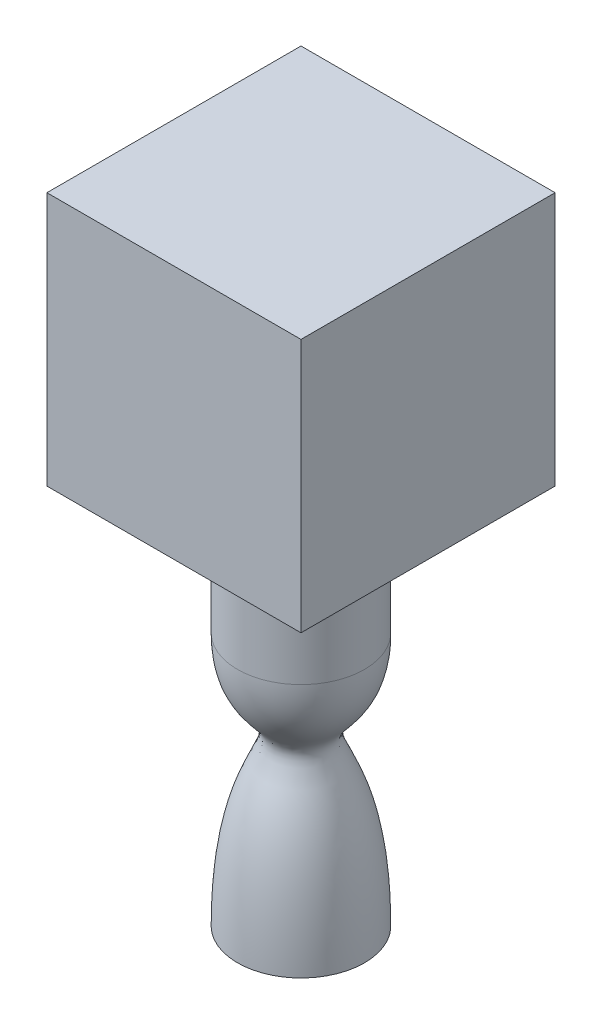
from build123d import *

# Parameters (mm, degrees)
REVOLVE1_OUTLINE_W   = 5
REVOLVE1_OUTLINE_H   = 100
REVOLVE1_OUTLINE_W_2 = 45
SKETCH2_W            = 200
SKETCH2_H            = 200
BOSS_EXTRUDE1_DEPTH  = 200


# Read off the part's stored shape, not the designer's step: Revolve1
with BuildPart() as part:
    # Revolve1 outline → Revolve1 (revolve)
    with BuildSketch(Plane(origin=(50, 0, 0), x_dir=(1, 0, 0), z_dir=(0, 0, 1))):
        with Locations((47.5, 50)):
            Rectangle(REVOLVE1_OUTLINE_W, REVOLVE1_OUTLINE_H)
        with BuildLine():
            add(Edge.make_bspline(
                [(50, 0), (50, -8.082762567), (49.349957781, -15.002219913), (48.209745328, -20.96390459), (46.719575094, -26.132708235), (45, -30.644804173)],
                knots=[0, 0, 0, 0, 0, 0, 0.122970463, 0.122970463, 0.122970463, 0.122970463, 0.122970463, 0.122970463], degree=5))
            Line((50, 0), (45, 0))
            Line((45, 0), (45, -30.644804173))
        make_face()
        with Locations((22.5, 50)):
            Rectangle(REVOLVE1_OUTLINE_W_2, REVOLVE1_OUTLINE_H)
        with BuildLine():
            add(Edge.make_bspline(
                [(45, -30.644804173), (34.455506857, -58.313130409), (15.284968329, -61.288036888), (15.284968329, -70.967793904), (34.455506857, -78.145887533), (45, -136.380827106)],
                knots=[0.122970463, 0.122970463, 0.122970463, 0.122970463, 0.122970463, 0.122970463, 0.877029537, 0.877029537, 0.877029537, 0.877029537, 0.877029537, 0.877029537], degree=5))
            Line((45, -30.644804173), (45, 0))
            add(Edge.make_bspline(
                [(45, 0), (45, -0.805913513), (44.983206143, -2.440345101), (44.885909174, -5.527357683), (44.651249209, -9.180617017), (44.208693768, -13.22104238), (43.429179035, -18.197149025), (42.145056936, -23.699932493), (40.238749724, -29.339291486), (38.077480396, -34.180232479), (34.979043101, -39.765346635), (30.901795474, -45.44053167), (26.211141954, -50.99117289), (22.123818579, -55.99940601), (19.504937862, -60.49603289), (18.327366237, -64.615511375), (18.036096382, -67.865198675), (18.325954828, -71.151011846), (19.354041911, -75.549666709), (21.595505158, -81.301527469), (25.440968359, -89.686697726), (29.365247929, -98.822414083), (32.703100041, -108.024070812), (35.228496377, -116.046022636), (37.689368772, -125.375404851), (39.98622015, -136.217854158), (41.670948279, -146.701049549), (42.819586689, -156.079119992), (43.564957316, -163.641363627), (44.177194916, -171.766381725), (44.561675987, -179.035635061), (44.784641201, -185.169118612), (44.907191495, -189.931856825), (44.970095656, -194.044527702), (44.995668899, -197.414073857), (45, -199.141583294), (45, -200)],
                knots=[0, 0, 0, 0, 0.0078125, 0.015625, 0.03125, 0.046875, 0.0625, 0.09375, 0.125, 0.15625, 0.1875, 0.25, 0.3125, 0.375, 0.4375, 0.46875, 0.5, 0.53125, 0.5625, 0.625, 0.6875, 0.75, 0.78125, 0.8125, 0.84375, 0.875, 0.90625, 0.921875, 0.9375, 0.953125, 0.96875, 0.9765625, 0.984375, 0.9921875, 0.99609375, 1, 1, 1, 1], degree=3))
            Line((45, -200), (45, -136.380827106))
        make_face()
        with BuildLine():
            Line((45, -200), (50, -200))
            add(Edge.make_bspline(
                [(45, -136.380827106), (46.719575094, -145.877665912), (48.209745328, -156.732333022), (49.349957781, -169.177110028), (50, -183.488669983), (50, -200)],
                knots=[0.877029537, 0.877029537, 0.877029537, 0.877029537, 0.877029537, 0.877029537, 1, 1, 1, 1, 1, 1], degree=5))
            Line((45, -136.380827106), (45, -200))
        make_face()
    revolve(axis=Axis((50, 0, 0), (0, 1, 0)))

    # Sketch2 → Boss-Extrude1 (add)
    with BuildSketch(Plane(origin=(0, 100, 0), x_dir=(1, 0, 0), z_dir=(0, 1, 0))):
        with Locations((50, 0)):
            Rectangle(SKETCH2_W, SKETCH2_H)
    extrude(amount=BOSS_EXTRUDE1_DEPTH)


solid = part.part
